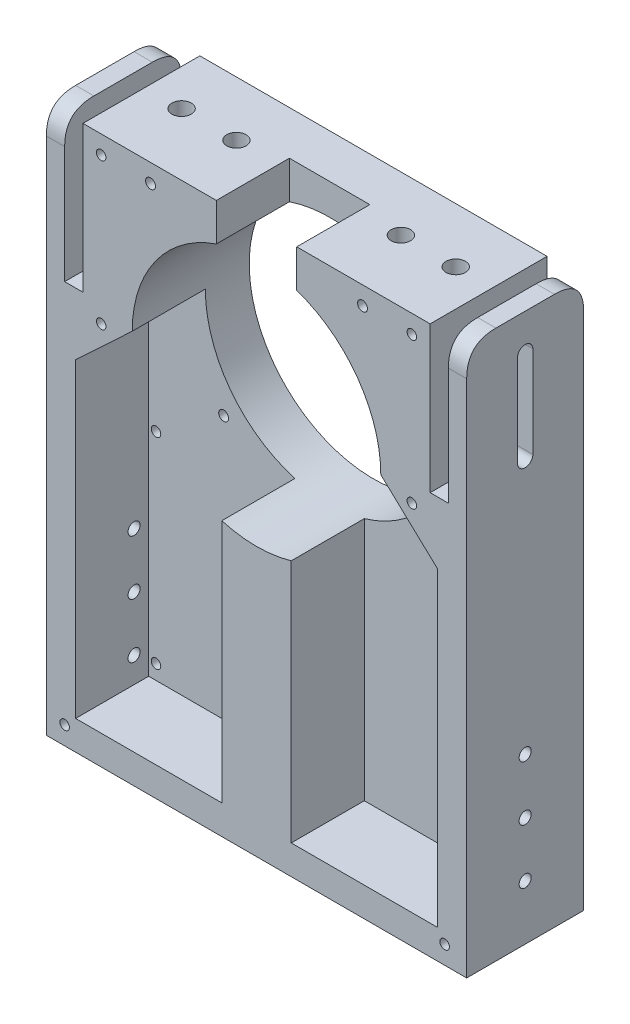
from build123d import *

# Parameters (mm, degrees)
SKETCH_1_W               = 115
SKETCH_1_H               = 150
EXTRUDE_1_DEPTH          = 32
SKETCH_2_R               = 34
CUT_EXTRUDE_1_DEPTH      = 100.775999118
SKETCH_3_W               = 40
SKETCH_3_H               = 85
CUT_EXTRUDE_2_DEPTH      = 20
F_1_0MM_2_D              = 2.6
SKETCH_8_W               = 5
SKETCH_8_H               = 40
CUT_EXTRUDE_3_DEPTH      = 100.775999118
CUT_EXTRUDE_4_REACH      = 165.799
CUT_EXTRUDE_4_END_RADIUS = 34
SKETCH_9_W               = 22
SKETCH_9_H               = 20
CUT_EXTRUDE_5_REACH      = 142.975
FILLET_1_SIZE            = 8
F_1_0MM_4_AT_2_COUNT     = 2
F_1_0MM_4_AT_2_PITCH     = 15
F_1_0MM_3_D              = 2.6
F_1_0MM_3_DEPTH          = 7.5
F_1_0MM_3_TIP            = 0.781118805
CUT_EXTRUDE_7_DEPTH      = 20
F_1_0MM_5_REACH          = 142.975
F_1_0MM_5_BORE_R         = 1.65
F_1_0MM_6_D              = 2.7


with BuildPart() as part:
    # 草圖1 → 填料-伸長1 (new body)
    with BuildSketch(Plane.XY):
        Rectangle(SKETCH_1_W, SKETCH_1_H)
    extrude(amount=EXTRUDE_1_DEPTH)

    # 草圖2 → 除料-伸長1 (cut, through all)
    with BuildSketch(Plane.XY.offset(32)):
        with Locations((0, 32.5)):
            Circle(SKETCH_2_R)
    extrude(amount=-CUT_EXTRUDE_1_DEPTH, mode=Mode.SUBTRACT)

    # 草圖3 → 除料-伸長2 (cut)
    with BuildSketch(Plane.XY.offset(32)):
        with Locations((-29.5, -24.5)):
            Rectangle(SKETCH_3_W, SKETCH_3_H)
    cut_extrude_2 = extrude(amount=-CUT_EXTRUDE_2_DEPTH, mode=Mode.SUBTRACT)

    # 鏡射1: 除料-伸長2 across plane
    add(cut_extrude_2.mirror(Plane(origin=(0, 0, 0), x_dir=(0, 0, 1), z_dir=(1, 0, 0))), mode=Mode.SUBTRACT)

    # Ø1.0mm 定位孔2 (through all)
    with Locations(Plane(origin=(0, 0, 0), x_dir=(-1, 0, 0), z_dir=(0, 0, -1))):
        with Locations((47.5, -8), (47.5, -63), (-47.5, -8), (-47.5, -63)):
            Hole(F_1_0MM_2_D / 2)

    # 草圖8 → 除料-伸長3 (cut, through all)
    with BuildSketch(Plane.XY.offset(32)):
        with Locations((-50, 55)):
            Rectangle(SKETCH_8_W, SKETCH_8_H)
    cut_extrude_3 = extrude(amount=-CUT_EXTRUDE_3_DEPTH, mode=Mode.SUBTRACT)

    # 鏡射2: 除料-伸長3 across plane
    add(cut_extrude_3.mirror(Plane(origin=(0, 0, 0), x_dir=(0, 0, 1), z_dir=(1, 0, 0))), mode=Mode.SUBTRACT)

    # 除料-伸長4: up to this cylinder (the profile starts outside it)
    cut_extrude_4_end = Plane(origin=(0, 32.5, 22), z_dir=(0, 0, 1)) * Cylinder(CUT_EXTRUDE_4_END_RADIUS, 400.598, mode=Mode.PRIVATE)
    # 草圖9 → 除料-伸長4 (cut, up to the surface)
    with BuildSketch(Plane(origin=(0, 75, 0), x_dir=(1, 0, 0), z_dir=(0, 1, 0)), mode=Mode.PRIVATE) as cut_extrude_4_sk1:
        with Locations((0, -22)):
            Rectangle(SKETCH_9_W, SKETCH_9_H)
    cut_extrude_4_tool1 = extrude(cut_extrude_4_sk1.sketch, amount=-CUT_EXTRUDE_4_REACH, mode=Mode.PRIVATE) - cut_extrude_4_end
    add(cut_extrude_4_tool1.solids().sort_by_distance((0, 75, 22))[0], mode=Mode.SUBTRACT)

    # 草圖11 → 除料-伸長5 (cut, up to next)
    with BuildSketch(Plane(origin=(57.5, 0, 0), x_dir=(0, 0, -1), z_dir=(1, 0, 0)), mode=Mode.PRIVATE) as cut_extrude_5_sk1:
        with BuildLine():
            Line((-13.9, 65), (-13.9, 40))
            ThreePointArc((-13.9, 40), (-16, 37.9), (-18.1, 40))
            Line((-18.1, 40), (-18.1, 65))
            ThreePointArc((-18.1, 65), (-16, 67.1), (-13.9, 65))
        make_face()
    cut_extrude_5_tool1 = extrude(cut_extrude_5_sk1.sketch, amount=-CUT_EXTRUDE_5_REACH, mode=Mode.PRIVATE) & part.part
    cut_extrude_5 = cut_extrude_5_tool1.solids().sort_by_distance((57.5, 52.5, 16))[0]
    add(cut_extrude_5, mode=Mode.SUBTRACT)

    # 鏡射3: 除料-伸長5 across plane
    add(cut_extrude_5.mirror(Plane(origin=(0, 0, 0), x_dir=(0, 0, 1), z_dir=(1, 0, 0))), mode=Mode.SUBTRACT)

    # 圓角1
    # a fillet whose section is not a circle: 8 mm, written as the material it takes off along each edge
    with BuildSketch(Plane(origin=(-32.5, 75, 32), x_dir=(0, -1, 0), z_dir=(-1, 0, 0))) as fillet_1_piece_1_section:
        with BuildLine():
            Bezier((FILLET_1_SIZE, 0), (0, 0), (0, -FILLET_1_SIZE), weights=[1, 1, 1])
            Line((0, -FILLET_1_SIZE), (0, 0))
            Line((0, 0), (FILLET_1_SIZE, 0))
        make_face()
    fillet_1_piece_1 = extrude(amount=45, mode=Mode.PRIVATE)
    fillet_1_piece_1 = split(fillet_1_piece_1, bisect_by=Plane(origin=(-47.5, 75, 32), z_dir=(-1, 0, 0)), keep=Keep.TOP, mode=Mode.PRIVATE)
    add(fillet_1_piece_1, mode=Mode.SUBTRACT)
    with BuildSketch(Plane(origin=(-32.5, 75, 0), x_dir=(0, -1, 0), z_dir=(-1, 0, 0))) as fillet_1_piece_2_section:
        with BuildLine():
            Bezier((FILLET_1_SIZE, 0), (0, 0), (0, FILLET_1_SIZE), weights=[1, 1, 1])
            Line((0, FILLET_1_SIZE), (0, 0))
            Line((0, 0), (FILLET_1_SIZE, 0))
        make_face()
    fillet_1_piece_2 = extrude(amount=45, mode=Mode.PRIVATE)
    fillet_1_piece_2 = split(fillet_1_piece_2, bisect_by=Plane(origin=(-47.5, 75, 0), z_dir=(-1, 0, 0)), keep=Keep.TOP, mode=Mode.PRIVATE)
    add(fillet_1_piece_2, mode=Mode.SUBTRACT)
    with BuildSketch(Plane(origin=(77.5, 75, 0), x_dir=(0, -1, 0), z_dir=(-1, 0, 0))) as fillet_1_piece_3:
        with BuildLine():
            Bezier((FILLET_1_SIZE, 0), (0, 0), (0, FILLET_1_SIZE), weights=[1, 1, 1])
            Line((0, FILLET_1_SIZE), (0, 0))
            Line((0, 0), (FILLET_1_SIZE, 0))
        make_face()
    extrude(amount=25, mode=Mode.SUBTRACT)
    with BuildSketch(Plane(origin=(77.5, 75, 32), x_dir=(0, -1, 0), z_dir=(-1, 0, 0))) as fillet_1_piece_4:
        with BuildLine():
            Bezier((FILLET_1_SIZE, 0), (0, 0), (0, -FILLET_1_SIZE), weights=[1, 1, 1])
            Line((0, -FILLET_1_SIZE), (0, 0))
            Line((0, 0), (FILLET_1_SIZE, 0))
        make_face()
    extrude(amount=25, mode=Mode.SUBTRACT)

    # 草圖13 → Ø1.0mm 定位孔4 (revolve, cut)
    with BuildSketch(Plane(origin=(-37.5, 75, 15), x_dir=(0, 0, 1), z_dir=(1, 0, 0))):
        Polygon((0, 0), (0, 16.59228064), (2.65, 15), (2.65, 0), align=None)
    f_1_0mm_4 = revolve(axis=Axis((-37.5, 81.35, 15), (0, -1, 0)), mode=Mode.SUBTRACT)

    # Ø1.0mm 定位孔4 at 2: Ø1.0mm 定位孔4 ×2
    with Locations(*[(i * F_1_0MM_4_AT_2_PITCH, 0, 0) for i in range(1, F_1_0MM_4_AT_2_COUNT)]):
        add(f_1_0mm_4, mode=Mode.SUBTRACT)

    # 鏡射4: Ø1.0mm 定位孔4 across plane
    add(f_1_0mm_4.mirror(Plane(origin=(0, 0, 0), x_dir=(0, 0, 1), z_dir=(1, 0, 0))), mode=Mode.SUBTRACT)

    # 鏡射4 copy 1 sketch → 鏡射4 copy 1 (revolve, cut)
    with BuildSketch(Plane(origin=(22.5, 75, 15), x_dir=(0, 0, 1), z_dir=(-1, 0, 0))):
        Polygon((0, 0), (0, -16.59228064), (2.65, -15), (2.65, 0), align=None)
    revolve(axis=Axis((22.5, 81.35, 15), (0, 1, 0)), mode=Mode.SUBTRACT)

    # Ø1.0mm 定位孔3
    with Locations(Plane.XY.offset(32)):
        with Locations((-52.5, -70), (51.464741732, -70), (-42.5, 70), (-42.5, 30), (42.5, 70), (42.5, 30)):
            Hole(F_1_0MM_3_D / 2, depth=F_1_0MM_3_DEPTH)
            with Locations((0, 0, -(F_1_0MM_3_DEPTH + F_1_0MM_3_TIP / 2))):  # 118° drill point
                Cone(0, F_1_0MM_3_D / 2, F_1_0MM_3_TIP, mode=Mode.SUBTRACT)

    # 草圖17 → 除料-伸長7 (cut)
    with BuildSketch(Plane.XY.offset(32)):
        with BuildLine():
            Line((-49.5, 18), (-34, 32.5))
            ThreePointArc((-34, 32.5), (-33.178333694, 25.070452685), (-30.753048629, 18))
            Line((-30.753048629, 18), (-49.5, 18))
        make_face()
    cut_extrude_7 = extrude(amount=-CUT_EXTRUDE_7_DEPTH, mode=Mode.SUBTRACT)

    # Ø1.0mm 定位孔5 bore → Ø1.0mm 定位孔5 (cut, up to next)
    with BuildSketch(Plane.ZY.offset(57.5), mode=Mode.PRIVATE) as f_1_0mm_5_sk1:
        with Locations((16, -60)):
            Circle(F_1_0MM_5_BORE_R)
    f_1_0mm_5_tool1 = extrude(f_1_0mm_5_sk1.sketch, amount=-F_1_0MM_5_REACH, mode=Mode.PRIVATE) & part.part
    # Ø1.0mm 定位孔5 bore → Ø1.0mm 定位孔5 (cut, up to next)
    with BuildSketch(Plane.ZY.offset(57.5), mode=Mode.PRIVATE) as f_1_0mm_5_sk2:
        with Locations((16, -45)):
            Circle(F_1_0MM_5_BORE_R)
    f_1_0mm_5_tool2 = extrude(f_1_0mm_5_sk2.sketch, amount=-F_1_0MM_5_REACH, mode=Mode.PRIVATE) & part.part
    # Ø1.0mm 定位孔5 bore → Ø1.0mm 定位孔5 (cut, up to next)
    with BuildSketch(Plane.ZY.offset(57.5), mode=Mode.PRIVATE) as f_1_0mm_5_sk3:
        with Locations((16, -30)):
            Circle(F_1_0MM_5_BORE_R)
    f_1_0mm_5_tool3 = extrude(f_1_0mm_5_sk3.sketch, amount=-F_1_0MM_5_REACH, mode=Mode.PRIVATE) & part.part
    f_1_0mm_5_1 = f_1_0mm_5_tool1.solids().sort_by_distance((-57.5, -60, 16))[0]
    add(f_1_0mm_5_1, mode=Mode.SUBTRACT)
    f_1_0mm_5_2 = f_1_0mm_5_tool2.solids().sort_by_distance((-57.5, -45, 16))[0]
    add(f_1_0mm_5_2, mode=Mode.SUBTRACT)
    f_1_0mm_5_3 = f_1_0mm_5_tool3.solids().sort_by_distance((-57.5, -30, 16))[0]
    add(f_1_0mm_5_3, mode=Mode.SUBTRACT)
    f_1_0mm_5 = f_1_0mm_5_1 + f_1_0mm_5_2 + f_1_0mm_5_3  # Ø1.0mm 定位孔5 as one shape, for the pattern or mirror that repeats it

    # 鏡射5: Ø1.0mm 定位孔5 across plane
    add(f_1_0mm_5.mirror(Plane(origin=(0, 0, 0), x_dir=(0, 0, 1), z_dir=(1, 0, 0))), mode=Mode.SUBTRACT)

    # 鏡射6: 除料-伸長7 across plane
    add(cut_extrude_7.mirror(Plane(origin=(0, 0, 0), x_dir=(0, 0, 1), z_dir=(1, 0, 0))), mode=Mode.SUBTRACT)

    # Ø1.0mm 定位孔6 (through all)
    with Locations(Plane(origin=(0, 0, 0), x_dir=(-1, 0, 0), z_dir=(0, 0, -1))):
        with Locations((-29, 70), (-29, 5), (29, 70), (29, 5)):
            Hole(F_1_0MM_6_D / 2)


solid = part.part
